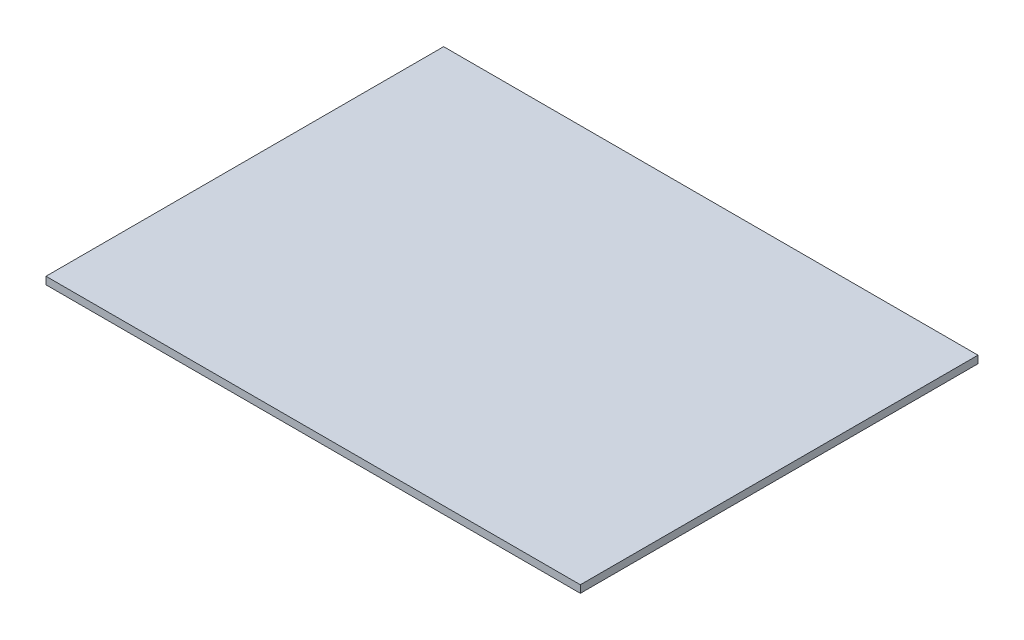
from build123d import *

# Parameters (mm, degrees)
SKETCH1_W           = 215
SKETCH1_H           = 160
BOSS_EXTRUDE1_DEPTH = 3


with BuildPart() as part:
    # Sketch1 → Boss-Extrude1 (new body)
    with BuildSketch(Plane(origin=(0, 210, 0), x_dir=(1, 0, 0), z_dir=(0, 1, 0))):
        Rectangle(SKETCH1_W, SKETCH1_H)
    extrude(amount=BOSS_EXTRUDE1_DEPTH)


solid = part.part
